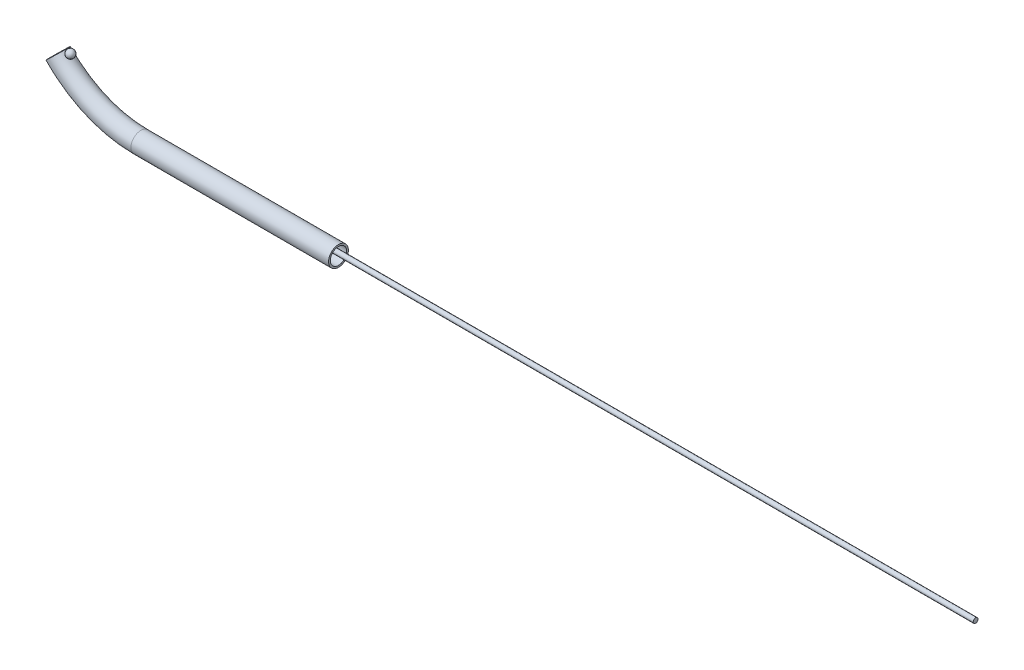
from build123d import *

# Parameters (mm, degrees)
SKETCH5_R           = 0.6223
SKETCH5_R_2         = 0.51435
SKETCH5_2_R         = 0.6223
SKETCH5_2_R_2       = 0.51435
BOSS_EXTRUDE2_DEPTH = 10
SKETCH8_R           = 0.15
SKETCH9_R           = 0.15
BOSS_EXTRUDE3_DEPTH = 40


with BuildPart() as part:
    # Sweep2: sweep along a path in Sketch4
    with BuildLine(Plane.XY) as sweep2_path:
        Line((-65.954222951, 0), (-68.364968213, 0))
        ThreePointArc((-68.364968213, 0), (-71.186123393, 0.579815367), (-73.549932813, 2.225265895))
    # Sketch5 → Sweep2 (sweep)
    with BuildSketch(Plane(origin=(-65.954222951, 0, 0), x_dir=(0, 0, -1), z_dir=(1, 0, 0))):
        Circle(SKETCH5_R)
        Circle(SKETCH5_R_2, mode=Mode.SUBTRACT)
    sweep(path=sweep2_path.line)

    # Sketch5<2> → Boss-Extrude2 (add)
    with BuildSketch(Plane(origin=(-65.954222951, 0, 0), x_dir=(0, 0, -1), z_dir=(1, 0, 0))):
        Circle(SKETCH5_2_R)
        Circle(SKETCH5_2_R_2, mode=Mode.SUBTRACT)
    extrude(amount=BOSS_EXTRUDE2_DEPTH)

    # Sketch6 → Revolve2 (revolve)
    with BuildSketch(Plane.XY):
        with BuildLine():
            Line((-72.949063517, 2.38792888), (-72.625665662, 2.76926053))
            ThreePointArc((-72.625665662, 2.76926053), (-72.596698765, 2.416895777), (-72.949063517, 2.38792888))
        make_face()
    revolve(axis=Axis((-72.949063517, 2.38792888, 0), (0.6467957105420484, 0.7626632997754689, 0)))


with BuildPart() as body_2:
    # Sweep3: sweep along a path in Sketch7
    with BuildLine(Plane.XY) as sweep3_path:
        Line((-55.954222951, 0.1777), (-68.364968213, 0.1777))
        ThreePointArc((-68.364968213, 0.1777), (-71.116040444, 0.743111633), (-73.421128268, 2.347685988))
    # Sketch8 → Sweep3 (sweep)
    with BuildSketch(Plane(origin=(-36.018221468, 37.89664365, 0), x_dir=(0.7248426853938525, 0.688914422429251, 0), z_dir=(-0.688914422429251, 0.7248426853938525, 0))):
        with Locations((-51.601413042, 0)):
            Circle(SKETCH8_R)
    sweep(path=sweep3_path.line)

    # Sketch9 → Boss-Extrude3 (add)
    with BuildSketch(Plane(origin=(-55.954222951, 0, 0), x_dir=(0, 0, -1), z_dir=(1, 0, 0))):
        with Locations((0, 0.1777)):
            Circle(SKETCH9_R)
    extrude(amount=BOSS_EXTRUDE3_DEPTH)


solid = Compound([part.part, body_2.part])
